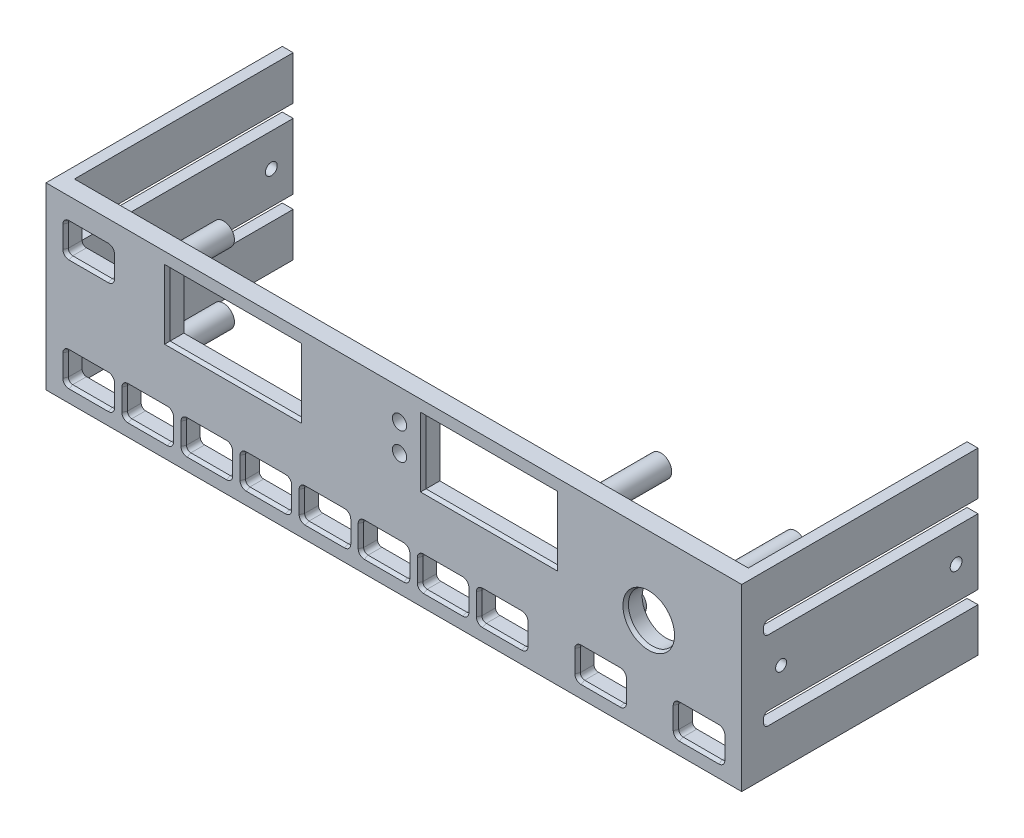
from build123d import *

# Parameters (mm, degrees)
ESQUISSE1_W             = 160
ESQUISSE1_H             = 41
BOSS_EXTRU_1_DEPTH      = 4
ESQUISSE2_R             = 5.5
ESQUISSE2_R_2           = 1.625
ESQUISSE2_W             = 30.5
ESQUISSE2_H             = 15
ENL_V_MAT_EXTRU_1_DEPTH = 4
ESQUISSE4_W             = 3
ESQUISSE4_H             = 41
BOSS_EXTRU_2_DEPTH      = 50
ENL_V_MAT_EXTRU_2_DEPTH = 173.571724219
ESQUISSE7_R             = 2.5
ESQUISSE7_R_2           = 1.25
BOSS_EXTRU_3_DEPTH      = 15
CHANFREIN1_SIZE         = 0.4
CHANFREIN1_SIZE2        = 0.857802768
ESQUISSE9_R             = 1.25
ESQUISSE9_R_2           = 1.35
ENL_V_MAT_EXTRU_3_DEPTH = 900
ESQUISSE10_W            = 12.385186808
ESQUISSE10_H            = 54.185192286
ESQUISSE10_W_2          = 10.977779216
ESQUISSE10_H_2          = 57.844452025
ENL_V_MAT_EXTRU_5_DEPTH = 174.772840225


with BuildPart() as part:
    # Esquisse1 → Boss.-Extru.1 (new body)
    with BuildSketch(Plane.XY):
        with Locations((80, 20.5)):
            Rectangle(ESQUISSE1_W, ESQUISSE1_H)
    extrude(amount=BOSS_EXTRU_1_DEPTH)

    # Esquisse2 → Enlèv. mat.-Extru.1 (cut)
    with BuildSketch(Plane.XY.offset(4)):
        with Locations((138.25, 23.25)):
            Circle(ESQUISSE2_R)
        with Locations((81.3, 34.05)):
            Circle(ESQUISSE2_R_2)
        with Locations((81.3, 27.83)):
            Circle(ESQUISSE2_R_2)
        with BuildLine():
            Line((19.25, 10.25), (28.25, 10.25))
            ThreePointArc((28.25, 10.25), (28.957106781, 9.957106781), (29.25, 9.25))
            Line((29.25, 9.25), (29.25, 4.25))
            ThreePointArc((29.25, 4.25), (28.957106781, 3.542893219), (28.25, 3.25))
            Line((28.25, 3.25), (19.25, 3.25))
            ThreePointArc((19.25, 3.25), (18.542893219, 3.542893219), (18.25, 4.25))
            Line((18.25, 4.25), (18.25, 9.25))
            ThreePointArc((18.25, 9.25), (18.542893219, 9.957106781), (19.25, 10.25))
        make_face()
        with BuildLine():
            Line((5.75, 3.25), (14.75, 3.25))
            ThreePointArc((14.75, 3.25), (15.457106781, 3.542893219), (15.75, 4.25))
            Line((15.75, 4.25), (15.75, 9.25))
            ThreePointArc((15.75, 9.25), (15.457106781, 9.957106781), (14.75, 10.25))
            Line((14.75, 10.25), (5.75, 10.25))
            ThreePointArc((5.75, 10.25), (5.042893219, 9.957106781), (4.75, 9.25))
            Line((4.75, 9.25), (4.75, 4.25))
            ThreePointArc((4.75, 4.25), (5.042893219, 3.542893219), (5.75, 3.25))
        make_face()
        with BuildLine():
            Line((32.75, 10.25), (41.75, 10.25))
            ThreePointArc((41.75, 10.25), (42.457106781, 9.957106781), (42.75, 9.25))
            Line((42.75, 9.25), (42.75, 4.25))
            ThreePointArc((42.75, 4.25), (42.457106781, 3.542893219), (41.75, 3.25))
            Line((41.75, 3.25), (32.75, 3.25))
            ThreePointArc((32.75, 3.25), (32.042893219, 3.542893219), (31.75, 4.25))
            Line((31.75, 4.25), (31.75, 9.25))
            ThreePointArc((31.75, 9.25), (32.042893219, 9.957106781), (32.75, 10.25))
        make_face()
        with BuildLine():
            Line((46.25, 10.25), (55.25, 10.25))
            ThreePointArc((55.25, 10.25), (55.957106781, 9.957106781), (56.25, 9.25))
            Line((56.25, 9.25), (56.25, 4.25))
            ThreePointArc((56.25, 4.25), (55.957106781, 3.542893219), (55.25, 3.25))
            Line((55.25, 3.25), (46.25, 3.25))
            ThreePointArc((46.25, 3.25), (45.542893219, 3.542893219), (45.25, 4.25))
            Line((45.25, 4.25), (45.25, 9.25))
            ThreePointArc((45.25, 9.25), (45.542893219, 9.957106781), (46.25, 10.25))
        make_face()
        with BuildLine():
            Line((59.75, 10.25), (68.75, 10.25))
            ThreePointArc((68.75, 10.25), (69.457106781, 9.957106781), (69.75, 9.25))
            Line((69.75, 9.25), (69.75, 4.25))
            ThreePointArc((69.75, 4.25), (69.457106781, 3.542893219), (68.75, 3.25))
            Line((68.75, 3.25), (59.75, 3.25))
            ThreePointArc((59.75, 3.25), (59.042893219, 3.542893219), (58.75, 4.25))
            Line((58.75, 4.25), (58.75, 9.25))
            ThreePointArc((58.75, 9.25), (59.042893219, 9.957106781), (59.75, 10.25))
        make_face()
        with BuildLine():
            Line((73.25, 10.25), (82.25, 10.25))
            ThreePointArc((82.25, 10.25), (82.957106781, 9.957106781), (83.25, 9.25))
            Line((83.25, 9.25), (83.25, 4.25))
            ThreePointArc((83.25, 4.25), (82.957106781, 3.542893219), (82.25, 3.25))
            Line((82.25, 3.25), (73.25, 3.25))
            ThreePointArc((73.25, 3.25), (72.542893219, 3.542893219), (72.25, 4.25))
            Line((72.25, 4.25), (72.25, 9.25))
            ThreePointArc((72.25, 9.25), (72.542893219, 9.957106781), (73.25, 10.25))
        make_face()
        with BuildLine():
            Line((86.75, 10.25), (95.75, 10.25))
            ThreePointArc((95.75, 10.25), (96.457106781, 9.957106781), (96.75, 9.25))
            Line((96.75, 9.25), (96.75, 4.25))
            ThreePointArc((96.75, 4.25), (96.457106781, 3.542893219), (95.75, 3.25))
            Line((95.75, 3.25), (86.75, 3.25))
            ThreePointArc((86.75, 3.25), (86.042893219, 3.542893219), (85.75, 4.25))
            Line((85.75, 4.25), (85.75, 9.25))
            ThreePointArc((85.75, 9.25), (86.042893219, 9.957106781), (86.75, 10.25))
        make_face()
        with BuildLine():
            Line((100.25, 10.25), (109.25, 10.25))
            ThreePointArc((109.25, 10.25), (109.957106781, 9.957106781), (110.25, 9.25))
            Line((110.25, 9.25), (110.25, 4.25))
            ThreePointArc((110.25, 4.25), (109.957106781, 3.542893219), (109.25, 3.25))
            Line((109.25, 3.25), (100.25, 3.25))
            ThreePointArc((100.25, 3.25), (99.542893219, 3.542893219), (99.25, 4.25))
            Line((99.25, 4.25), (99.25, 9.25))
            ThreePointArc((99.25, 9.25), (99.542893219, 9.957106781), (100.25, 10.25))
        make_face()
        with BuildLine():
            Line((122.75, 3.25), (131.75, 3.25))
            ThreePointArc((131.75, 3.25), (132.457106781, 3.542893219), (132.75, 4.25))
            Line((132.75, 4.25), (132.75, 9.25))
            ThreePointArc((132.75, 9.25), (132.457106781, 9.957106781), (131.75, 10.25))
            Line((131.75, 10.25), (122.75, 10.25))
            ThreePointArc((122.75, 10.25), (122.042893219, 9.957106781), (121.75, 9.25))
            Line((121.75, 9.25), (121.75, 4.25))
            ThreePointArc((121.75, 4.25), (122.042893219, 3.542893219), (122.75, 3.25))
        make_face()
        with BuildLine():
            Line((145.25, 3.25), (154.25, 3.25))
            ThreePointArc((154.25, 3.25), (154.957106781, 3.542893219), (155.25, 4.25))
            Line((155.25, 4.25), (155.25, 9.25))
            ThreePointArc((155.25, 9.25), (154.957106781, 9.957106781), (154.25, 10.25))
            Line((154.25, 10.25), (145.25, 10.25))
            ThreePointArc((145.25, 10.25), (144.542893219, 9.957106781), (144.25, 9.25))
            Line((144.25, 9.25), (144.25, 4.25))
            ThreePointArc((144.25, 4.25), (144.542893219, 3.542893219), (145.25, 3.25))
        make_face()
        with BuildLine():
            Line((5.75, 35.75), (14.75, 35.75))
            ThreePointArc((14.75, 35.75), (15.457106781, 35.457106781), (15.75, 34.75))
            Line((15.75, 34.75), (15.75, 29.75))
            ThreePointArc((15.75, 29.75), (15.457106781, 29.042893219), (14.75, 28.75))
            Line((14.75, 28.75), (5.75, 28.75))
            ThreePointArc((5.75, 28.75), (5.042893219, 29.042893219), (4.75, 29.75))
            Line((4.75, 29.75), (4.75, 34.75))
            ThreePointArc((4.75, 34.75), (5.042893219, 35.457106781), (5.75, 35.75))
        make_face()
        with Locations((43.25, 30.5)):
            Rectangle(ESQUISSE2_W, ESQUISSE2_H)
        with Locations((101.75, 30.5)):
            Rectangle(ESQUISSE2_W, ESQUISSE2_H)
    extrude(amount=-ENL_V_MAT_EXTRU_1_DEPTH, mode=Mode.SUBTRACT)

    # Esquisse4 → Boss.-Extru.2 (add)
    with BuildSketch(Plane(origin=(0, 0, 0), x_dir=(-1, 0, 0), z_dir=(0, 0, -1))):
        with Locations((-158.5, 20.5)):
            Rectangle(ESQUISSE4_W, ESQUISSE4_H)
        with Locations((-1.5, 20.5)):
            Rectangle(ESQUISSE4_W, ESQUISSE4_H)
    extrude(amount=BOSS_EXTRU_2_DEPTH)

    # Esquisse5 → Enlèv. mat.-Extru.2 (cut, through all)
    with BuildSketch(Plane(origin=(160, 0, 0), x_dir=(0, 0, -1), z_dir=(1, 0, 0))):
        with BuildLine():
            Line((50, 13), (2, 13))
            ThreePointArc((2, 13), (1.292893219, 12.707106781), (1, 12))
            Line((1, 12), (1, 11))
            ThreePointArc((1, 11), (1.292893219, 10.292893219), (2, 10))
            Line((2, 10), (50, 10))
            Line((50, 10), (50, 13))
        make_face()
        with BuildLine():
            Line((50, 31), (2, 31))
            ThreePointArc((2, 31), (1.292893219, 30.707106781), (1, 30))
            Line((1, 30), (1, 29))
            ThreePointArc((1, 29), (1.292893219, 28.292893219), (2, 28))
            Line((2, 28), (50, 28))
            Line((50, 28), (50, 31))
        make_face()
    extrude(amount=-ENL_V_MAT_EXTRU_2_DEPTH, mode=Mode.SUBTRACT)

    # Esquisse7 → Boss.-Extru.3 (add)
    # profile 1 of 7: a face of its own
    with BuildSketch(Plane(origin=(0, 0, 0), x_dir=(-1, 0, 0), z_dir=(0, 0, -1))):
        with Locations((-22.066417501, 32.220467417)):
            Circle(ESQUISSE7_R)
        with Locations((-22.066417501, 32.220467417)):
            Circle(ESQUISSE7_R_2, mode=Mode.SUBTRACT)
    # profile 2 of 7: a face of its own
    with BuildSketch(Plane(origin=(0, 0, 0), x_dir=(-1, 0, 0), z_dir=(0, 0, -1))):
        with Locations((-22.066417501, 15.960655172)):
            Circle(ESQUISSE7_R)
        with Locations((-22.066417501, 15.960655172)):
            Circle(ESQUISSE7_R_2, mode=Mode.SUBTRACT)
    # profile 3 of 7: a face of its own
    with BuildSketch(Plane(origin=(0, 0, 0), x_dir=(-1, 0, 0), z_dir=(0, 0, -1))):
        with Locations((-152.81245368, 36.297265299)):
            Circle(ESQUISSE7_R)
        with Locations((-152.81245368, 36.297265299)):
            Circle(ESQUISSE7_R_2, mode=Mode.SUBTRACT)
    # profile 4 of 7: a face of its own
    with BuildSketch(Plane(origin=(0, 0, 0), x_dir=(-1, 0, 0), z_dir=(0, 0, -1))):
        with Locations((-152.81245368, 14.495559759)):
            Circle(ESQUISSE7_R)
        with Locations((-152.81245368, 14.495559759)):
            Circle(ESQUISSE7_R_2, mode=Mode.SUBTRACT)
    # profile 5 of 7: a face of its own
    with BuildSketch(Plane(origin=(0, 0, 0), x_dir=(-1, 0, 0), z_dir=(0, 0, -1))):
        with Locations((-122, 36.297265299)):
            Circle(ESQUISSE7_R)
        with Locations((-122, 36.297265299)):
            Circle(ESQUISSE7_R_2, mode=Mode.SUBTRACT)
    # profile 6 of 7: a face of its own
    with BuildSketch(Plane(origin=(0, 0, 0), x_dir=(-1, 0, 0), z_dir=(0, 0, -1))):
        with Locations((-116.25, 6.75)):
            Circle(ESQUISSE7_R)
        with Locations((-116.25, 6.75)):
            Circle(ESQUISSE7_R_2, mode=Mode.SUBTRACT)
    # profile 7 of 7: a face of its own
    with BuildSketch(Plane(origin=(0, 0, 0), x_dir=(-1, 0, 0), z_dir=(0, 0, -1))):
        with Locations((-63.5, 14.495559759)):
            Circle(ESQUISSE7_R)
        with Locations((-63.5, 14.495559759)):
            Circle(ESQUISSE7_R_2, mode=Mode.SUBTRACT)
    extrude(amount=BOSS_EXTRU_3_DEPTH)

    # Chanfrein1
    chanfrein1_edges = [part.edges().sort_by_distance(p)[0] for p in [
        (101.75, 38, 4),
        (117, 30.5, 4),
        (101.75, 23, 4),
        (86.5, 30.5, 4),
        (58.5, 30.5, 4),
        (43.25, 23, 4),
        (28, 30.5, 4),
        (43.25, 38, 4),
        (132.75, 23.25, 4),
        (149.75, 3.25, 4),
        (154.957106781, 3.542893219, 4),
        (144.542893219, 3.542893219, 4),
        (155.25, 6.75, 4),
        (144.25, 6.75, 4),
        (154.957106781, 9.957106781, 4),
        (144.542893219, 9.957106781, 4),
        (149.75, 10.25, 4),
        (127.25, 3.25, 4),
        (132.457106781, 3.542893219, 4),
        (122.042893219, 3.542893219, 4),
        (132.75, 6.75, 4),
        (121.75, 6.75, 4),
        (132.457106781, 9.957106781, 4),
        (122.042893219, 9.957106781, 4),
        (127.25, 10.25, 4),
        (104.75, 3.25, 4),
        (109.957106781, 3.542893219, 4),
        (99.542893219, 3.542893219, 4),
        (110.25, 6.75, 4),
        (99.25, 6.75, 4),
        (109.957106781, 9.957106781, 4),
        (99.542893219, 9.957106781, 4),
        (104.75, 10.25, 4),
        (91.25, 3.25, 4),
        (96.457106781, 3.542893219, 4),
        (86.042893219, 3.542893219, 4),
        (96.75, 6.75, 4),
        (85.75, 6.75, 4),
        (96.457106781, 9.957106781, 4),
        (86.042893219, 9.957106781, 4),
        (91.25, 10.25, 4),
        (77.75, 3.25, 4),
        (82.957106781, 3.542893219, 4),
        (72.542893219, 3.542893219, 4),
        (83.25, 6.75, 4),
        (72.25, 6.75, 4),
        (82.957106781, 9.957106781, 4),
        (72.542893219, 9.957106781, 4),
        (77.75, 10.25, 4),
        (64.25, 3.25, 4),
        (69.457106781, 3.542893219, 4),
        (59.042893219, 3.542893219, 4),
        (69.75, 6.75, 4),
        (58.75, 6.75, 4),
        (69.457106781, 9.957106781, 4),
        (59.042893219, 9.957106781, 4),
        (64.25, 10.25, 4),
        (50.75, 3.25, 4),
        (55.957106781, 3.542893219, 4),
        (45.542893219, 3.542893219, 4),
        (56.25, 6.75, 4),
        (45.25, 6.75, 4),
        (55.957106781, 9.957106781, 4),
        (45.542893219, 9.957106781, 4),
        (50.75, 10.25, 4),
        (37.25, 3.25, 4),
        (42.457106781, 3.542893219, 4),
        (32.042893219, 3.542893219, 4),
        (42.75, 6.75, 4),
        (31.75, 6.75, 4),
        (42.457106781, 9.957106781, 4),
        (32.042893219, 9.957106781, 4),
        (37.25, 10.25, 4),
        (23.75, 3.25, 4),
        (28.957106781, 3.542893219, 4),
        (18.542893219, 3.542893219, 4),
        (29.25, 6.75, 4),
        (18.25, 6.75, 4),
        (28.957106781, 9.957106781, 4),
        (18.542893219, 9.957106781, 4),
        (23.75, 10.25, 4),
        (10.25, 3.25, 4),
        (15.457106781, 3.542893219, 4),
        (5.042893219, 3.542893219, 4),
        (15.75, 6.75, 4),
        (4.75, 6.75, 4),
        (15.457106781, 9.957106781, 4),
        (5.042893219, 9.957106781, 4),
        (10.25, 10.25, 4),
        (10.25, 35.75, 4),
        (5.042893219, 35.457106781, 4),
        (15.457106781, 35.457106781, 4),
        (4.75, 32.25, 4),
        (15.75, 32.25, 4),
        (5.042893219, 29.042893219, 4),
        (15.457106781, 29.042893219, 4),
        (10.25, 28.75, 4),
    ]]
    chanfrein1_side = [part.faces().sort_by_distance(p)[0] for p in [
        (82.430470131, 20.497923343, 4),
    ]]
    chamfer(chanfrein1_edges, length=CHANFREIN1_SIZE, length2=CHANFREIN1_SIZE2, reference=chanfrein1_side[0])

    # Esquisse9 → Enlèv. mat.-Extru.3 (cut)
    with BuildSketch(Plane(origin=(160, 0, 0), x_dir=(0, 0, -1), z_dir=(1, 0, 0))):
        with Locations((5, 20.5)):
            Circle(ESQUISSE9_R)
        with Locations((45, 20.5)):
            Circle(ESQUISSE9_R_2)
    extrude(amount=-ENL_V_MAT_EXTRU_3_DEPTH, mode=Mode.SUBTRACT)

    # Esquisse10 → Enlèv. mat.-Extru.5 (cut, through all)
    with BuildSketch(Plane.XY.offset(4)):
        with Locations((-5.692593404, 19.595563324)):
            Rectangle(ESQUISSE10_W, ESQUISSE10_H)
        with Locations((164.988889608, 19.032600287)):
            Rectangle(ESQUISSE10_W_2, ESQUISSE10_H_2)
    extrude(amount=-ENL_V_MAT_EXTRU_5_DEPTH, mode=Mode.SUBTRACT)


solid = part.part
